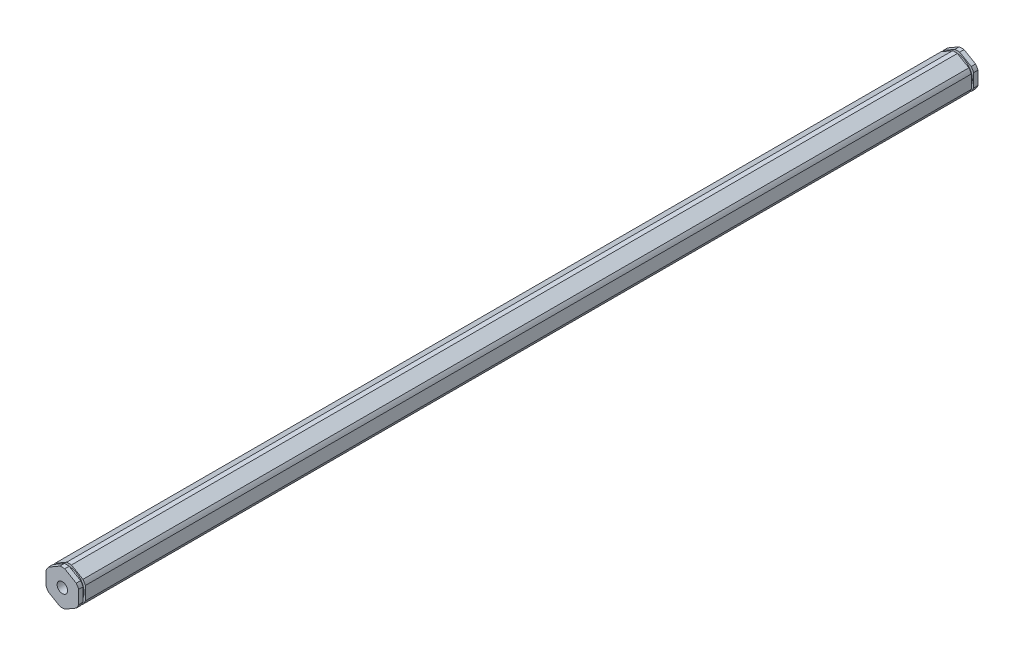
from build123d import *

# Parameters (mm, degrees)
BOSS_EXTRUDE1_DEPTH                  = 174.91075
F_10_32_TAPPED_HOLE1_D               = 4.0386
F_10_32_TAPPED_HOLE1_DEPTH           = 16.34744
F_10_32_TAPPED_HOLE1_TIP             = 1.213317848
F_10_32_TAPPED_HOLE1_ON_FACE_2_D     = 4.0386
F_10_32_TAPPED_HOLE1_ON_FACE_2_DEPTH = 16.34744
F_10_32_TAPPED_HOLE1_ON_FACE_2_TIP   = 1.213317848
SKETCH3_W                            = 0.889
SKETCH3_H                            = 1.0033


with BuildPart() as part:
    # Sketch1 → Boss-Extrude1 (new, symmetric)
    with BuildSketch(Plane.XY):
        with BuildLine():
            ThreePointArc((0.93173274, 6.79441227), (0, 6.858), (-0.93173274, 6.79441227))
            Line((-0.93173274, 6.79441227), (-5.41826726, 4.204110358))
            ThreePointArc((-5.41826726, 4.204110358), (-5.939202219, 3.429), (-6.35, 2.590301913))
            Line((-6.35, 2.590301913), (-6.35, -2.590301913))
            ThreePointArc((-6.35, -2.590301913), (-5.939202219, -3.429), (-5.41826726, -4.204110358))
            Line((-5.41826726, -4.204110358), (-0.93173274, -6.79441227))
            ThreePointArc((-0.93173274, -6.79441227), (0, -6.858), (0.93173274, -6.79441227))
            Line((0.93173274, -6.79441227), (5.41826726, -4.204110358))
            ThreePointArc((5.41826726, -4.204110358), (5.939202219, -3.429), (6.35, -2.590301913))
            Line((6.35, -2.590301913), (6.35, 2.590301913))
            ThreePointArc((6.35, 2.590301913), (5.939202219, 3.429), (5.41826726, 4.204110358))
            Line((5.41826726, 4.204110358), (0.93173274, 6.79441227))
        make_face()
    extrude(amount=BOSS_EXTRUDE1_DEPTH, both=True)

    # #10-32 Tapped Hole1
    with Locations(Plane.XY.offset(174.91075)):
        with Locations((0, 0)):
            Hole(F_10_32_TAPPED_HOLE1_D / 2, depth=F_10_32_TAPPED_HOLE1_DEPTH)
            with Locations((0, 0, -(F_10_32_TAPPED_HOLE1_DEPTH + F_10_32_TAPPED_HOLE1_TIP / 2))):  # 118° drill point
                Cone(0, F_10_32_TAPPED_HOLE1_D / 2, F_10_32_TAPPED_HOLE1_TIP, mode=Mode.SUBTRACT)

    # #10-32 Tapped Hole1 on face 2
    with Locations(Plane(origin=(0, 0, -174.91075), x_dir=(-1, 0, 0), z_dir=(0, 0, -1))):
        with Locations((0, 0)):
            Hole(F_10_32_TAPPED_HOLE1_ON_FACE_2_D / 2, depth=F_10_32_TAPPED_HOLE1_ON_FACE_2_DEPTH)
            with Locations((0, 0, -(F_10_32_TAPPED_HOLE1_ON_FACE_2_DEPTH + F_10_32_TAPPED_HOLE1_ON_FACE_2_TIP / 2))):  # 118° drill point
                Cone(0, F_10_32_TAPPED_HOLE1_ON_FACE_2_D / 2, F_10_32_TAPPED_HOLE1_ON_FACE_2_TIP, mode=Mode.SUBTRACT)

    # Sketch3 → Cut-Revolve1 (revolve, cut)
    with BuildSketch(Plane(origin=(0, 0, 0), x_dir=(0, 0, -1), z_dir=(1, 0, 0))):
        with Locations((-172.75175, 6.35635)):
            Rectangle(SKETCH3_W, SKETCH3_H)
    cut_revolve1 = revolve(axis=Axis((0, 0, 175.157387885), (0, 0, -1)), mode=Mode.SUBTRACT)

    # Mirror1: Cut-Revolve1 across plane
    add(cut_revolve1.mirror(Plane.XY), mode=Mode.SUBTRACT)


solid = part.part
